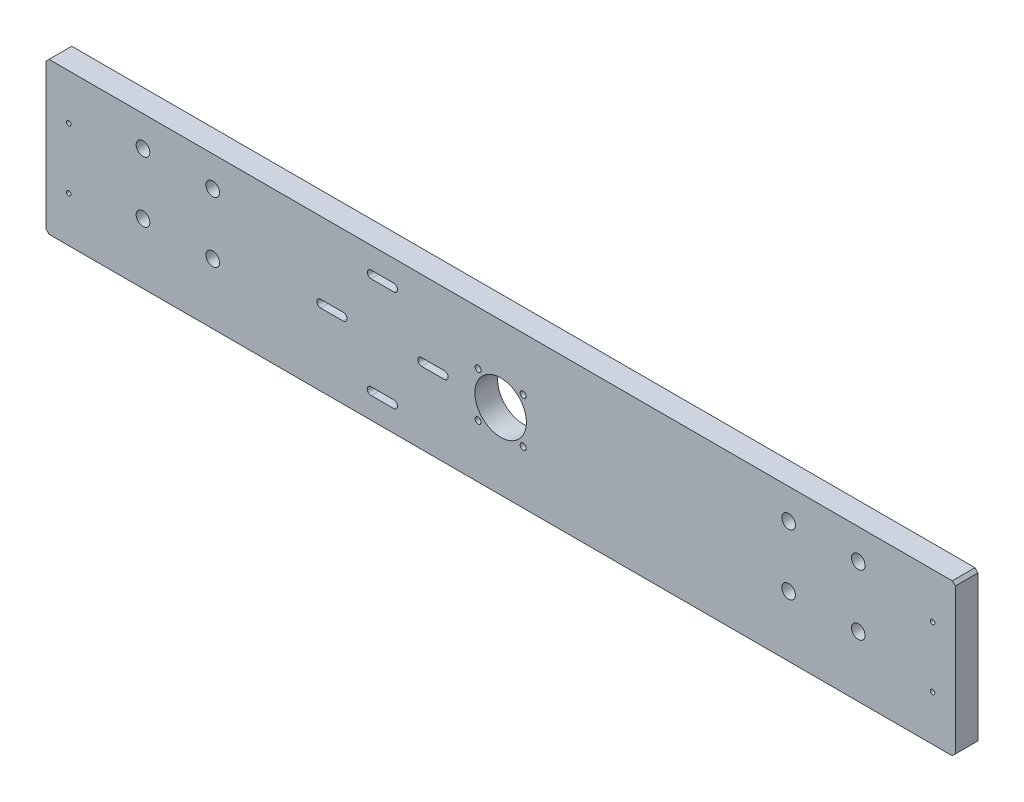
from build123d import *

# Parameters (mm, degrees)
SCHIZZO1_R            = 17
SCHIZZO1_R_2          = 2
SCHIZZO1_R_3          = 4.5
SCHIZZO1_R_4          = 1.5
BOSS_EXTRUDE1_DEPTH   = 15
M8_TAPPED_HOLE1_D     = 6.8
M8_TAPPED_HOLE1_DEPTH = 23.75
M8_TAPPED_HOLE1_TIP   = 2.042926105
CUT_EXTRUDE1_DEPTH    = 609.461173782


with BuildPart() as part:
    # Schizzo1 → Boss-Extrude1 (new body)
    with BuildSketch(Plane.XY):
        Polygon((2, 0), (598, 0), (600, 2), (600, 98), (598, 100), (2, 100), (0, 98), (0, 2), align=None)
        with Locations((300, 50)):
            Circle(SCHIZZO1_R, mode=Mode.SUBTRACT)
        with Locations((314.849242405, 64.849242405)):
            Circle(SCHIZZO1_R_2, mode=Mode.SUBTRACT)
        with Locations((314.849242405, 35.150757595)):
            Circle(SCHIZZO1_R_2, mode=Mode.SUBTRACT)
        with Locations((285.150757595, 35.150757595)):
            Circle(SCHIZZO1_R_2, mode=Mode.SUBTRACT)
        with Locations((536, 40)):
            Circle(SCHIZZO1_R_3, mode=Mode.SUBTRACT)
        with Locations((536, 80)):
            Circle(SCHIZZO1_R_3, mode=Mode.SUBTRACT)
        with Locations((490, 40)):
            Circle(SCHIZZO1_R_3, mode=Mode.SUBTRACT)
        with Locations((490, 80)):
            Circle(SCHIZZO1_R_3, mode=Mode.SUBTRACT)
        with Locations((585, 70)):
            Circle(SCHIZZO1_R_4, mode=Mode.SUBTRACT)
        with Locations((585, 30)):
            Circle(SCHIZZO1_R_4, mode=Mode.SUBTRACT)
        with Locations((15, 30)):
            Circle(SCHIZZO1_R_4, mode=Mode.SUBTRACT)
        with Locations((285.150757595, 64.849242405)):
            Circle(SCHIZZO1_R_2, mode=Mode.SUBTRACT)
        with Locations((15, 70)):
            Circle(SCHIZZO1_R_4, mode=Mode.SUBTRACT)
        with Locations((110, 80)):
            Circle(SCHIZZO1_R_3, mode=Mode.SUBTRACT)
        with Locations((110, 40)):
            Circle(SCHIZZO1_R_3, mode=Mode.SUBTRACT)
        with Locations((64, 80)):
            Circle(SCHIZZO1_R_3, mode=Mode.SUBTRACT)
        with Locations((64, 40)):
            Circle(SCHIZZO1_R_3, mode=Mode.SUBTRACT)
    extrude(amount=-BOSS_EXTRUDE1_DEPTH)

    # M8 Tapped Hole1
    with Locations(Plane(origin=(30, 0, -7.5), x_dir=(0, 0, -1), z_dir=(0, -1, 0))):
        with Locations((0, 0), (0, 540)):
            Hole(M8_TAPPED_HOLE1_D / 2, depth=M8_TAPPED_HOLE1_DEPTH)
            with Locations((0, 0, -(M8_TAPPED_HOLE1_DEPTH + M8_TAPPED_HOLE1_TIP / 2))):  # 118° drill point
                Cone(0, M8_TAPPED_HOLE1_D / 2, M8_TAPPED_HOLE1_TIP, mode=Mode.SUBTRACT)

    # Sketch7 → Cut-Extrude1 (cut, through all)
    with BuildSketch(Plane(origin=(0, 0, -15), x_dir=(-1, 0, 0), z_dir=(0, 0, -1))):
        with BuildLine():
            Line((-214.5, 80.833013665), (-229.5, 80.833013665))
            ThreePointArc((-229.5, 80.833013665), (-232, 83.333013665), (-229.5, 85.833013665))
            Line((-229.5, 85.833013665), (-214.5, 85.833013665))
            ThreePointArc((-214.5, 85.833013665), (-212, 83.333013665), (-214.5, 80.833013665))
        make_face()
        with BuildLine():
            Line((-247.833013665, 47.5), (-262.833013665, 47.5))
            ThreePointArc((-262.833013665, 47.5), (-265.333013665, 50), (-262.833013665, 52.5))
            Line((-262.833013665, 52.5), (-247.833013665, 52.5))
            ThreePointArc((-247.833013665, 52.5), (-245.333013665, 50), (-247.833013665, 47.5))
        make_face()
        with BuildLine():
            Line((-181.166986335, 47.5), (-196.166986335, 47.5))
            ThreePointArc((-196.166986335, 47.5), (-198.666986335, 50), (-196.166986335, 52.5))
            Line((-196.166986335, 52.5), (-181.166986335, 52.5))
            ThreePointArc((-181.166986335, 52.5), (-178.666986335, 50), (-181.166986335, 47.5))
        make_face()
        with BuildLine():
            Line((-214.5, 14.166986335), (-229.5, 14.166986335))
            ThreePointArc((-229.5, 14.166986335), (-232, 16.666986335), (-229.5, 19.166986335))
            Line((-229.5, 19.166986335), (-214.5, 19.166986335))
            ThreePointArc((-214.5, 19.166986335), (-212, 16.666986335), (-214.5, 14.166986335))
        make_face()
    extrude(amount=-CUT_EXTRUDE1_DEPTH, mode=Mode.SUBTRACT)


solid = part.part
